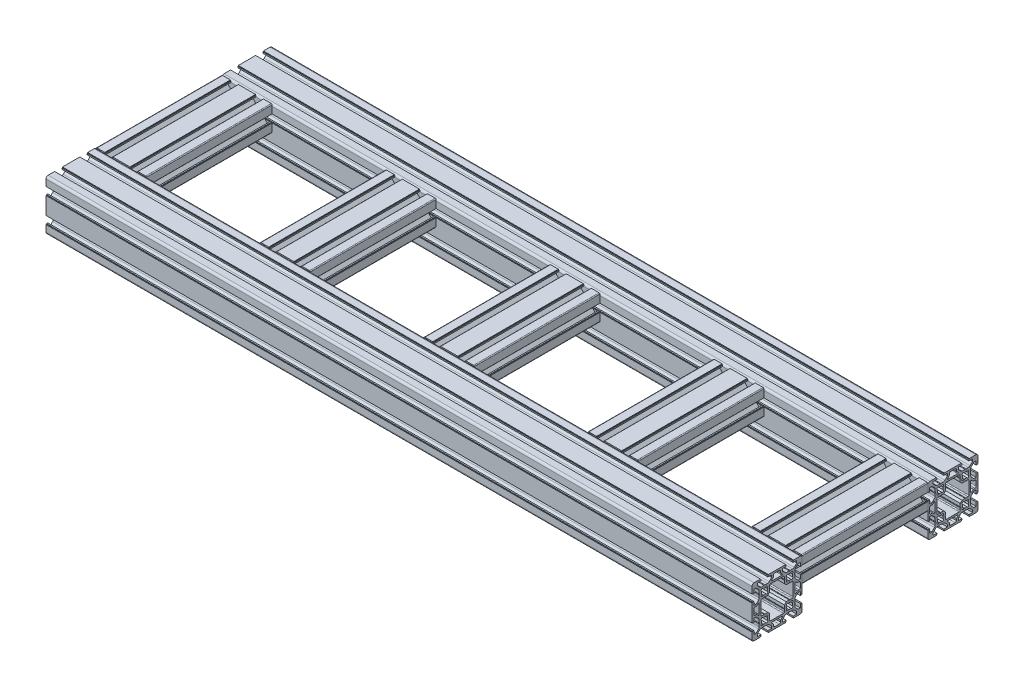
from build123d import *

# Parameters (mm, degrees)
T_SLOT_START                 = -421.5
T_SLOT_CNCCAT_6060_1_DEPTH   = 843
T_SLOT_CNCCAT_6060_1_2_DEPTH = 843
SKETCH24_W                   = 3.960773678
SKETCH24_H                   = 3.960773678
T_SLOT_CNCCAT_3060_1_DEPTH   = 270
LPATTERN1_COUNT              = 5
LPATTERN1_PITCH              = 195.75


with BuildPart() as part:
    # T-slot CNCCAT-6060(1): read off the stored shape, not the designer's step
    # T-slot CNCCAT-6060(1) outline → T-slot CNCCAT-6060(1) (new body)
    with BuildSketch(Plane.YZ.offset(T_SLOT_START)):
        with BuildLine():
            Line((10.9, 2.2), (6.454151397, 2.2))
            Line((6.454151397, 2.2), (6.454151397, 4.924610005))
            Line((6.454151397, 4.924610005), (9.459049047, 7.929507655))
            ThreePointArc((9.459049047, 7.929507655), (10.299878939, 8.491332227), (11.291705423, 8.688618781))
            Line((11.291705423, 8.688618781), (14.439031423, 8.688618781))
            ThreePointArc((14.439031423, 8.688618781), (15, 9.249587358), (15.560968577, 8.688618781))
            Line((15.560968577, 8.688618781), (18.708294577, 8.688618781))
            ThreePointArc((18.708294577, 8.688618781), (19.700121061, 8.491332227), (20.540950953, 7.929507655))
            Line((20.540950953, 7.929507655), (23.545848603, 4.924610005))
            Line((23.545848603, 4.924610005), (23.545848603, 2.2))
            Line((23.545848603, 2.2), (19.1, 2.2))
            Line((19.1, 2.2), (19.1, 0.691051723))
            Line((19.1, 0.691051723), (19.647543128, 0.691051723))
            Line((19.647543128, 0.691051723), (19.647543128, 0))
            Line((19.647543128, 0), (27.5, 0))
            ThreePointArc((27.5, 0), (29.267766953, 0.732233047), (30, 2.5))
            Line((30, 2.5), (30, 10.352456872))
            Line((30, 10.352456872), (29.308948277, 10.352456872))
            Line((29.308948277, 10.352456872), (29.308948277, 10.9))
            Line((29.308948277, 10.9), (27.8, 10.9))
            Line((27.8, 10.9), (27.8, 6.454151397))
            Line((27.8, 6.454151397), (25.075389995, 6.454151397))
            Line((25.075389995, 6.454151397), (22.070492345, 9.459049047))
            ThreePointArc((22.070492345, 9.459049047), (21.508667773, 10.299878939), (21.311381219, 11.291705423))
            Line((21.311381219, 11.291705423), (21.311381219, 14.439031423))
            ThreePointArc((21.311381219, 14.439031423), (20.750412642, 15), (21.311381219, 15.560968577))
            Line((21.311381219, 15.560968577), (21.311381219, 18.708294577))
            ThreePointArc((21.311381219, 18.708294577), (21.508667773, 19.700121061), (22.070492345, 20.540950953))
            Line((22.070492345, 20.540950953), (25.075389995, 23.545848603))
            Line((25.075389995, 23.545848603), (27.8, 23.545848603))
            Line((27.8, 23.545848603), (27.8, 19.1))
            Line((27.8, 19.1), (29.308948277, 19.1))
            Line((29.308948277, 19.1), (29.308948277, 19.647543128))
            Line((29.308948277, 19.647543128), (30, 19.647543128))
            Line((30, 19.647543128), (30, 40.352456872))
            Line((30, 40.352456872), (29.308948277, 40.352456872))
            Line((29.308948277, 40.352456872), (29.308948277, 40.9))
            Line((29.308948277, 40.9), (27.8, 40.9))
            Line((27.8, 40.9), (27.8, 36.454151397))
            Line((27.8, 36.454151397), (25.075389995, 36.454151397))
            Line((25.075389995, 36.454151397), (22.070492345, 39.459049047))
            ThreePointArc((22.070492345, 39.459049047), (21.508667773, 40.299878939), (21.311381219, 41.291705423))
            Line((21.311381219, 41.291705423), (21.311381219, 44.439031423))
            ThreePointArc((21.311381219, 44.439031423), (20.750412642, 45), (21.311381219, 45.560968577))
            Line((21.311381219, 45.560968577), (21.311381219, 48.708294577))
            ThreePointArc((21.311381219, 48.708294577), (21.508667773, 49.700121061), (22.070492345, 50.540950953))
            Line((22.070492345, 50.540950953), (25.075389995, 53.545848603))
            Line((25.075389995, 53.545848603), (27.8, 53.545848603))
            Line((27.8, 53.545848603), (27.8, 49.1))
            Line((27.8, 49.1), (29.308948277, 49.1))
            Line((29.308948277, 49.1), (29.308948277, 49.647543128))
            Line((29.308948277, 49.647543128), (30, 49.647543128))
            Line((30, 49.647543128), (30, 57.5))
            ThreePointArc((30, 57.5), (29.267766953, 59.267766953), (27.5, 60))
            Line((27.5, 60), (19.647543128, 60))
            Line((19.647543128, 60), (19.647543128, 59.308948277))
            Line((19.647543128, 59.308948277), (19.1, 59.308948277))
            Line((19.1, 59.308948277), (19.1, 57.8))
            Line((19.1, 57.8), (23.545848603, 57.8))
            Line((23.545848603, 57.8), (23.545848603, 55.075389995))
            Line((23.545848603, 55.075389995), (20.540950953, 52.070492345))
            ThreePointArc((20.540950953, 52.070492345), (19.700121061, 51.508667773), (18.708294577, 51.311381219))
            Line((18.708294577, 51.311381219), (15.560968577, 51.311381219))
            ThreePointArc((15.560968577, 51.311381219), (15, 50.750412642), (14.439031423, 51.311381219))
            Line((14.439031423, 51.311381219), (11.291705423, 51.311381219))
            ThreePointArc((11.291705423, 51.311381219), (10.299878939, 51.508667773), (9.459049047, 52.070492345))
            Line((9.459049047, 52.070492345), (6.454151397, 55.075389995))
            Line((6.454151397, 55.075389995), (6.454151397, 57.8))
            Line((6.454151397, 57.8), (10.9, 57.8))
            Line((10.9, 57.8), (10.9, 59.308948277))
            Line((10.9, 59.308948277), (10.352456872, 59.308948277))
            Line((10.352456872, 59.308948277), (10.352456872, 60))
            Line((10.352456872, 60), (-10.352456872, 60))
            Line((-10.352456872, 60), (-10.352456872, 59.308948277))
            Line((-10.352456872, 59.308948277), (-10.9, 59.308948277))
            Line((-10.9, 59.308948277), (-10.9, 57.8))
            Line((-10.9, 57.8), (-6.454151397, 57.8))
            Line((-6.454151397, 57.8), (-6.454151397, 55.075389995))
            Line((-6.454151397, 55.075389995), (-9.459049047, 52.070492345))
            ThreePointArc((-9.459049047, 52.070492345), (-10.299878939, 51.508667773), (-11.291705423, 51.311381219))
            Line((-11.291705423, 51.311381219), (-14.439031423, 51.311381219))
            ThreePointArc((-14.439031423, 51.311381219), (-15, 50.750412642), (-15.560968577, 51.311381219))
            Line((-15.560968577, 51.311381219), (-18.708294577, 51.311381219))
            ThreePointArc((-18.708294577, 51.311381219), (-19.700121061, 51.508667773), (-20.540950953, 52.070492345))
            Line((-20.540950953, 52.070492345), (-23.545848603, 55.075389995))
            Line((-23.545848603, 55.075389995), (-23.545848603, 57.8))
            Line((-23.545848603, 57.8), (-19.1, 57.8))
            Line((-19.1, 57.8), (-19.1, 59.308948277))
            Line((-19.1, 59.308948277), (-19.647543128, 59.308948277))
            Line((-19.647543128, 59.308948277), (-19.647543128, 60))
            Line((-19.647543128, 60), (-27.5, 60))
            ThreePointArc((-27.5, 60), (-29.267766953, 59.267766953), (-30, 57.5))
            Line((-30, 57.5), (-30, 49.647543128))
            Line((-30, 49.647543128), (-29.308948277, 49.647543128))
            Line((-29.308948277, 49.647543128), (-29.308948277, 49.1))
            Line((-29.308948277, 49.1), (-27.8, 49.1))
            Line((-27.8, 49.1), (-27.8, 53.545848603))
            Line((-27.8, 53.545848603), (-25.075389995, 53.545848603))
            Line((-25.075389995, 53.545848603), (-22.070492345, 50.540950953))
            ThreePointArc((-22.070492345, 50.540950953), (-21.508667773, 49.700121061), (-21.311381219, 48.708294577))
            Line((-21.311381219, 48.708294577), (-21.311381219, 45.560968577))
            ThreePointArc((-21.311381219, 45.560968577), (-20.750412642, 45), (-21.311381219, 44.439031423))
            Line((-21.311381219, 44.439031423), (-21.311381219, 41.291705423))
            ThreePointArc((-21.311381219, 41.291705423), (-21.508667773, 40.299878939), (-22.070492345, 39.459049047))
            Line((-22.070492345, 39.459049047), (-25.075389995, 36.454151397))
            Line((-25.075389995, 36.454151397), (-27.8, 36.454151397))
            Line((-27.8, 36.454151397), (-27.8, 40.9))
            Line((-27.8, 40.9), (-29.308948277, 40.9))
            Line((-29.308948277, 40.9), (-29.308948277, 40.352456872))
            Line((-29.308948277, 40.352456872), (-30, 40.352456872))
            Line((-30, 40.352456872), (-30, 19.647543128))
            Line((-30, 19.647543128), (-29.308948277, 19.647543128))
            Line((-29.308948277, 19.647543128), (-29.308948277, 19.1))
            Line((-29.308948277, 19.1), (-27.8, 19.1))
            Line((-27.8, 19.1), (-27.8, 23.545848603))
            Line((-27.8, 23.545848603), (-25.075389995, 23.545848603))
            Line((-25.075389995, 23.545848603), (-22.070492345, 20.540950953))
            ThreePointArc((-22.070492345, 20.540950953), (-21.508667773, 19.700121061), (-21.311381219, 18.708294577))
            Line((-21.311381219, 18.708294577), (-21.311381219, 15.560968577))
            ThreePointArc((-21.311381219, 15.560968577), (-20.750412642, 15), (-21.311381219, 14.439031423))
            Line((-21.311381219, 14.439031423), (-21.311381219, 11.291705423))
            ThreePointArc((-21.311381219, 11.291705423), (-21.508667773, 10.299878939), (-22.070492345, 9.459049047))
            Line((-22.070492345, 9.459049047), (-25.075389995, 6.454151397))
            Line((-25.075389995, 6.454151397), (-27.8, 6.454151397))
            Line((-27.8, 6.454151397), (-27.8, 10.9))
            Line((-27.8, 10.9), (-29.308948277, 10.9))
            Line((-29.308948277, 10.9), (-29.308948277, 10.352456872))
            Line((-29.308948277, 10.352456872), (-30, 10.352456872))
            Line((-30, 10.352456872), (-30, 2.5))
            ThreePointArc((-30, 2.5), (-29.267766953, 0.732233047), (-27.5, 0))
            Line((-27.5, 0), (-19.647543128, 0))
            Line((-19.647543128, 0), (-19.647543128, 0.691051723))
            Line((-19.647543128, 0.691051723), (-19.1, 0.691051723))
            Line((-19.1, 0.691051723), (-19.1, 2.2))
            Line((-19.1, 2.2), (-23.545848603, 2.2))
            Line((-23.545848603, 2.2), (-23.545848603, 4.924610005))
            Line((-23.545848603, 4.924610005), (-20.540950953, 7.929507655))
            ThreePointArc((-20.540950953, 7.929507655), (-19.700121061, 8.491332227), (-18.708294577, 8.688618781))
            Line((-18.708294577, 8.688618781), (-15.560968577, 8.688618781))
            ThreePointArc((-15.560968577, 8.688618781), (-15, 9.249587358), (-14.439031423, 8.688618781))
            Line((-14.439031423, 8.688618781), (-11.291705423, 8.688618781))
            ThreePointArc((-11.291705423, 8.688618781), (-10.299878939, 8.491332227), (-9.459049047, 7.929507655))
            Line((-9.459049047, 7.929507655), (-6.454151397, 4.924610005))
            Line((-6.454151397, 4.924610005), (-6.454151397, 2.2))
            Line((-6.454151397, 2.2), (-10.9, 2.2))
            Line((-10.9, 2.2), (-10.9, 0.691051723))
            Line((-10.9, 0.691051723), (-10.352456872, 0.691051723))
            Line((-10.352456872, 0.691051723), (-10.352456872, 0))
            Line((-10.352456872, 0), (10.352456872, 0))
            Line((10.352456872, 0), (10.352456872, 0.691051723))
            Line((10.352456872, 0.691051723), (10.9, 0.691051723))
            Line((10.9, 0.691051723), (10.9, 2.2))
        make_face()
        with BuildLine():
            ThreePointArc((-16.842597476, 11.397388916), (-18.602611084, 11.397388916), (-18.602611084, 13.157402524))
            Line((-18.602611084, 13.157402524), (-18.193140614, 13.566872993))
            ThreePointArc((-18.193140614, 13.566872993), (-18.5, 15), (-18.193140614, 16.433127007))
            Line((-18.193140614, 16.433127007), (-18.602611084, 16.842597476))
            ThreePointArc((-18.602611084, 16.842597476), (-18.602611084, 18.602611084), (-16.842597476, 18.602611084))
            Line((-16.842597476, 18.602611084), (-16.433127007, 18.193140614))
            ThreePointArc((-16.433127007, 18.193140614), (-15, 18.5), (-13.566872993, 18.193140614))
            Line((-13.566872993, 18.193140614), (-13.157402524, 18.602611084))
            ThreePointArc((-13.157402524, 18.602611084), (-11.397388916, 18.602611084), (-11.397388916, 16.842597476))
            Line((-11.397388916, 16.842597476), (-11.806859386, 16.433127007))
            ThreePointArc((-11.806859386, 16.433127007), (-11.5, 15), (-11.806859386, 13.566872993))
            Line((-11.806859386, 13.566872993), (-11.397388916, 13.157402524))
            ThreePointArc((-11.397388916, 13.157402524), (-11.397388916, 11.397388916), (-13.157402524, 11.397388916))
            Line((-13.157402524, 11.397388916), (-13.566872993, 11.806859386))
            ThreePointArc((-13.566872993, 11.806859386), (-15, 11.5), (-16.433127007, 11.806859386))
            Line((-16.433127007, 11.806859386), (-16.842597476, 11.397388916))
        make_face(mode=Mode.SUBTRACT)
        with BuildLine():
            ThreePointArc((4.26564751, 3.554594496), (3.694557458, 2.582797776), (2.634369467, 2.2))
            Line((2.634369467, 2.2), (-2.634369467, 2.2))
            ThreePointArc((-2.634369467, 2.2), (-3.694557458, 2.582797776), (-4.26564751, 3.554594496))
            Line((-4.26564751, 3.554594496), (-4.26564751, 5.603852837))
            Line((-4.26564751, 5.603852837), (-6.282040861, 7.75997248))
            ThreePointArc((-6.282040861, 7.75997248), (-6.388091607, 8.373205301), (-5.867763364, 8.714613814))
            Line((-5.867763364, 8.714613814), (5.867763364, 8.714613814))
            ThreePointArc((5.867763364, 8.714613814), (6.388091607, 8.373205301), (6.282040861, 7.75997248))
            Line((6.282040861, 7.75997248), (4.26564751, 5.603852837))
            Line((4.26564751, 5.603852837), (4.26564751, 3.554594496))
        make_face(mode=Mode.SUBTRACT)
        with BuildLine():
            ThreePointArc((13.157402524, 11.397388916), (11.397388916, 11.397388916), (11.397388916, 13.157402524))
            Line((11.397388916, 13.157402524), (11.806859386, 13.566872993))
            ThreePointArc((11.806859386, 13.566872993), (11.5, 15), (11.806859386, 16.433127007))
            Line((11.806859386, 16.433127007), (11.397388916, 16.842597476))
            ThreePointArc((11.397388916, 16.842597476), (11.397388916, 18.602611084), (13.157402524, 18.602611084))
            Line((13.157402524, 18.602611084), (13.566872993, 18.193140614))
            ThreePointArc((13.566872993, 18.193140614), (15, 18.5), (16.433127007, 18.193140614))
            Line((16.433127007, 18.193140614), (16.842597476, 18.602611084))
            ThreePointArc((16.842597476, 18.602611084), (18.602611084, 18.602611084), (18.602611084, 16.842597476))
            Line((18.602611084, 16.842597476), (18.193140614, 16.433127007))
            ThreePointArc((18.193140614, 16.433127007), (18.5, 15), (18.193140614, 13.566872993))
            Line((18.193140614, 13.566872993), (18.602611084, 13.157402524))
            ThreePointArc((18.602611084, 13.157402524), (18.602611084, 11.397388916), (16.842597476, 11.397388916))
            Line((16.842597476, 11.397388916), (16.433127007, 11.806859386))
            ThreePointArc((16.433127007, 11.806859386), (15, 11.5), (13.566872993, 11.806859386))
            Line((13.566872993, 11.806859386), (13.157402524, 11.397388916))
        make_face(mode=Mode.SUBTRACT)
        with BuildLine():
            Line((-22.24002752, 23.717959139), (-24.396147163, 25.73435249))
            Line((-24.396147163, 25.73435249), (-26.445405504, 25.73435249))
            ThreePointArc((-26.445405504, 25.73435249), (-27.417202224, 26.305442542), (-27.8, 27.365630533))
            Line((-27.8, 27.365630533), (-27.8, 32.634369467))
            ThreePointArc((-27.8, 32.634369467), (-27.417202224, 33.694557458), (-26.445405504, 34.26564751))
            Line((-26.445405504, 34.26564751), (-24.396147163, 34.26564751))
            Line((-24.396147163, 34.26564751), (-22.24002752, 36.282040861))
            ThreePointArc((-22.24002752, 36.282040861), (-21.626794699, 36.388091607), (-21.285386186, 35.867763364))
            Line((-21.285386186, 35.867763364), (-21.285386186, 24.132236636))
            ThreePointArc((-21.285386186, 24.132236636), (-21.626794699, 23.611908393), (-22.24002752, 23.717959139))
        make_face(mode=Mode.SUBTRACT)
        with BuildLine():
            ThreePointArc((-13.157402524, 48.602611084), (-11.397388916, 48.602611084), (-11.397388916, 46.842597476))
            Line((-11.397388916, 46.842597476), (-11.806859386, 46.433127007))
            ThreePointArc((-11.806859386, 46.433127007), (-11.5, 45), (-11.806859386, 43.566872993))
            Line((-11.806859386, 43.566872993), (-11.397388916, 43.157402524))
            ThreePointArc((-11.397388916, 43.157402524), (-11.397388916, 41.397388916), (-13.157402524, 41.397388916))
            Line((-13.157402524, 41.397388916), (-13.566872993, 41.806859386))
            ThreePointArc((-13.566872993, 41.806859386), (-15, 41.5), (-16.433127007, 41.806859386))
            Line((-16.433127007, 41.806859386), (-16.842597476, 41.397388916))
            ThreePointArc((-16.842597476, 41.397388916), (-18.602611084, 41.397388916), (-18.602611084, 43.157402524))
            Line((-18.602611084, 43.157402524), (-18.193140614, 43.566872993))
            ThreePointArc((-18.193140614, 43.566872993), (-18.5, 45), (-18.193140614, 46.433127007))
            Line((-18.193140614, 46.433127007), (-18.602611084, 46.842597476))
            ThreePointArc((-18.602611084, 46.842597476), (-18.602611084, 48.602611084), (-16.842597476, 48.602611084))
            Line((-16.842597476, 48.602611084), (-16.433127007, 48.193140614))
            ThreePointArc((-16.433127007, 48.193140614), (-15, 48.5), (-13.566872993, 48.193140614))
            Line((-13.566872993, 48.193140614), (-13.157402524, 48.602611084))
        make_face(mode=Mode.SUBTRACT)
        with BuildLine():
            ThreePointArc((-8.800723479, 14.442432576), (-9.303525214, 14.945234311), (-8.800723479, 15.448036046))
            Line((-8.800723479, 15.448036046), (-8.800723479, 19.001733605))
            Line((-8.800723479, 19.001733605), (-10.998266395, 21.199276521))
            Line((-10.998266395, 21.199276521), (-14.551963954, 21.199276521))
            ThreePointArc((-14.551963954, 21.199276521), (-15.054765689, 20.696474786), (-15.557567424, 21.199276521))
            Line((-15.557567424, 21.199276521), (-18.034191115, 21.199276521))
            ThreePointArc((-18.034191115, 21.199276521), (-18.830657122, 21.529183543), (-19.160564144, 22.32564955))
            Line((-19.160564144, 22.32564955), (-19.160564144, 37.67435045))
            ThreePointArc((-19.160564144, 37.67435045), (-18.830657122, 38.470816457), (-18.034191115, 38.800723479))
            Line((-18.034191115, 38.800723479), (-15.557567424, 38.800723479))
            ThreePointArc((-15.557567424, 38.800723479), (-15.054765689, 39.303525214), (-14.551963954, 38.800723479))
            Line((-14.551963954, 38.800723479), (-10.998266395, 38.800723479))
            Line((-10.998266395, 38.800723479), (-8.800723479, 40.998266395))
            Line((-8.800723479, 40.998266395), (-8.800723479, 44.551963954))
            ThreePointArc((-8.800723479, 44.551963954), (-9.303525214, 45.054765689), (-8.800723479, 45.557567424))
            Line((-8.800723479, 45.557567424), (-8.800723479, 48.034191115))
            ThreePointArc((-8.800723479, 48.034191115), (-8.470816457, 48.830657122), (-7.67435045, 49.160564144))
            Line((-7.67435045, 49.160564144), (7.67435045, 49.160564144))
            ThreePointArc((7.67435045, 49.160564144), (8.470816457, 48.830657122), (8.800723479, 48.034191115))
            Line((8.800723479, 48.034191115), (8.800723479, 45.557567424))
            ThreePointArc((8.800723479, 45.557567424), (9.303525214, 45.054765689), (8.800723479, 44.551963954))
            Line((8.800723479, 44.551963954), (8.800723479, 40.998266395))
            Line((8.800723479, 40.998266395), (10.998266395, 38.800723479))
            Line((10.998266395, 38.800723479), (14.551963954, 38.800723479))
            ThreePointArc((14.551963954, 38.800723479), (15.054765689, 39.303525214), (15.557567424, 38.800723479))
            Line((15.557567424, 38.800723479), (18.034191115, 38.800723479))
            ThreePointArc((18.034191115, 38.800723479), (18.830657122, 38.470816457), (19.160564144, 37.67435045))
            Line((19.160564144, 37.67435045), (19.160564144, 22.32564955))
            ThreePointArc((19.160564144, 22.32564955), (18.830657122, 21.529183543), (18.034191115, 21.199276521))
            Line((18.034191115, 21.199276521), (15.557567424, 21.199276521))
            ThreePointArc((15.557567424, 21.199276521), (15.054765689, 20.696474786), (14.551963954, 21.199276521))
            Line((14.551963954, 21.199276521), (10.998266395, 21.199276521))
            Line((10.998266395, 21.199276521), (8.800723479, 19.001733605))
            Line((8.800723479, 19.001733605), (8.800723479, 15.448036046))
            ThreePointArc((8.800723479, 15.448036046), (9.303525214, 14.945234311), (8.800723479, 14.442432576))
            Line((8.800723479, 14.442432576), (8.800723479, 11.965808885))
            ThreePointArc((8.800723479, 11.965808885), (8.470816457, 11.169342878), (7.67435045, 10.839435856))
            Line((7.67435045, 10.839435856), (-7.67435045, 10.839435856))
            ThreePointArc((-7.67435045, 10.839435856), (-8.470816457, 11.169342878), (-8.800723479, 11.965808885))
            Line((-8.800723479, 11.965808885), (-8.800723479, 14.442432576))
        make_face(mode=Mode.SUBTRACT)
        with BuildLine():
            Line((22.24002752, 36.282040861), (24.396147163, 34.26564751))
            Line((24.396147163, 34.26564751), (26.445405504, 34.26564751))
            ThreePointArc((26.445405504, 34.26564751), (27.417202224, 33.694557458), (27.8, 32.634369467))
            Line((27.8, 32.634369467), (27.8, 27.365630533))
            ThreePointArc((27.8, 27.365630533), (27.417202224, 26.305442542), (26.445405504, 25.73435249))
            Line((26.445405504, 25.73435249), (24.396147163, 25.73435249))
            Line((24.396147163, 25.73435249), (22.24002752, 23.717959139))
            ThreePointArc((22.24002752, 23.717959139), (21.626794699, 23.611908393), (21.285386186, 24.132236636))
            Line((21.285386186, 24.132236636), (21.285386186, 35.867763364))
            ThreePointArc((21.285386186, 35.867763364), (21.626794699, 36.388091607), (22.24002752, 36.282040861))
        make_face(mode=Mode.SUBTRACT)
        with BuildLine():
            ThreePointArc((6.282040861, 52.24002752), (6.388091607, 51.626794699), (5.867763364, 51.285386186))
            Line((5.867763364, 51.285386186), (-5.867763364, 51.285386186))
            ThreePointArc((-5.867763364, 51.285386186), (-6.388091607, 51.626794699), (-6.282040861, 52.24002752))
            Line((-6.282040861, 52.24002752), (-4.26564751, 54.396147163))
            Line((-4.26564751, 54.396147163), (-4.26564751, 56.445405504))
            ThreePointArc((-4.26564751, 56.445405504), (-3.694557458, 57.417202224), (-2.634369467, 57.8))
            Line((-2.634369467, 57.8), (2.634369467, 57.8))
            ThreePointArc((2.634369467, 57.8), (3.694557458, 57.417202224), (4.26564751, 56.445405504))
            Line((4.26564751, 56.445405504), (4.26564751, 54.396147163))
            Line((4.26564751, 54.396147163), (6.282040861, 52.24002752))
        make_face(mode=Mode.SUBTRACT)
        with BuildLine():
            ThreePointArc((16.842597476, 48.602611084), (18.602611084, 48.602611084), (18.602611084, 46.842597476))
            Line((18.602611084, 46.842597476), (18.193140614, 46.433127007))
            ThreePointArc((18.193140614, 46.433127007), (18.5, 45), (18.193140614, 43.566872993))
            Line((18.193140614, 43.566872993), (18.602611084, 43.157402524))
            ThreePointArc((18.602611084, 43.157402524), (18.602611084, 41.397388916), (16.842597476, 41.397388916))
            Line((16.842597476, 41.397388916), (16.433127007, 41.806859386))
            ThreePointArc((16.433127007, 41.806859386), (15, 41.5), (13.566872993, 41.806859386))
            Line((13.566872993, 41.806859386), (13.157402524, 41.397388916))
            ThreePointArc((13.157402524, 41.397388916), (11.397388916, 41.397388916), (11.397388916, 43.157402524))
            Line((11.397388916, 43.157402524), (11.806859386, 43.566872993))
            ThreePointArc((11.806859386, 43.566872993), (11.5, 45), (11.806859386, 46.433127007))
            Line((11.806859386, 46.433127007), (11.397388916, 46.842597476))
            ThreePointArc((11.397388916, 46.842597476), (11.397388916, 48.602611084), (13.157402524, 48.602611084))
            Line((13.157402524, 48.602611084), (13.566872993, 48.193140614))
            ThreePointArc((13.566872993, 48.193140614), (15, 48.5), (16.433127007, 48.193140614))
            Line((16.433127007, 48.193140614), (16.842597476, 48.602611084))
        make_face(mode=Mode.SUBTRACT)
    extrude(amount=T_SLOT_CNCCAT_6060_1_DEPTH)


with BuildPart() as body_2:
    # T-slot CNCCAT-6060_1 2 outline → T-slot CNCCAT-6060_1 2 (new body)
    with BuildSketch(Plane.YZ.offset(T_SLOT_START)):
        with BuildLine():
            Line((10.9, 212.2), (6.454151397, 212.2))
            Line((6.454151397, 212.2), (6.454151397, 214.924610005))
            Line((6.454151397, 214.924610005), (9.459049047, 217.929507655))
            ThreePointArc((9.459049047, 217.929507655), (10.299878939, 218.491332227), (11.291705423, 218.688618781))
            Line((11.291705423, 218.688618781), (14.439031423, 218.688618781))
            ThreePointArc((14.439031423, 218.688618781), (15, 219.249587358), (15.560968577, 218.688618781))
            Line((15.560968577, 218.688618781), (18.708294577, 218.688618781))
            ThreePointArc((18.708294577, 218.688618781), (19.700121061, 218.491332227), (20.540950953, 217.929507655))
            Line((20.540950953, 217.929507655), (23.545848603, 214.924610005))
            Line((23.545848603, 214.924610005), (23.545848603, 212.2))
            Line((23.545848603, 212.2), (19.1, 212.2))
            Line((19.1, 212.2), (19.1, 210.691051723))
            Line((19.1, 210.691051723), (19.647543128, 210.691051723))
            Line((19.647543128, 210.691051723), (19.647543128, 210))
            Line((19.647543128, 210), (27.5, 210))
            ThreePointArc((27.5, 210), (29.267766953, 210.732233047), (30, 212.5))
            Line((30, 212.5), (30, 220.352456872))
            Line((30, 220.352456872), (29.308948277, 220.352456872))
            Line((29.308948277, 220.352456872), (29.308948277, 220.9))
            Line((29.308948277, 220.9), (27.8, 220.9))
            Line((27.8, 220.9), (27.8, 216.454151397))
            Line((27.8, 216.454151397), (25.075389995, 216.454151397))
            Line((25.075389995, 216.454151397), (22.070492345, 219.459049047))
            ThreePointArc((22.070492345, 219.459049047), (21.508667773, 220.299878939), (21.311381219, 221.291705423))
            Line((21.311381219, 221.291705423), (21.311381219, 224.439031423))
            ThreePointArc((21.311381219, 224.439031423), (20.750412642, 225), (21.311381219, 225.560968577))
            Line((21.311381219, 225.560968577), (21.311381219, 228.708294577))
            ThreePointArc((21.311381219, 228.708294577), (21.508667773, 229.700121061), (22.070492345, 230.540950953))
            Line((22.070492345, 230.540950953), (25.075389995, 233.545848603))
            Line((25.075389995, 233.545848603), (27.8, 233.545848603))
            Line((27.8, 233.545848603), (27.8, 229.1))
            Line((27.8, 229.1), (29.308948277, 229.1))
            Line((29.308948277, 229.1), (29.308948277, 229.647543128))
            Line((29.308948277, 229.647543128), (30, 229.647543128))
            Line((30, 229.647543128), (30, 250.352456872))
            Line((30, 250.352456872), (29.308948277, 250.352456872))
            Line((29.308948277, 250.352456872), (29.308948277, 250.9))
            Line((29.308948277, 250.9), (27.8, 250.9))
            Line((27.8, 250.9), (27.8, 246.454151397))
            Line((27.8, 246.454151397), (25.075389995, 246.454151397))
            Line((25.075389995, 246.454151397), (22.070492345, 249.459049047))
            ThreePointArc((22.070492345, 249.459049047), (21.508667773, 250.299878939), (21.311381219, 251.291705423))
            Line((21.311381219, 251.291705423), (21.311381219, 254.439031423))
            ThreePointArc((21.311381219, 254.439031423), (20.750412642, 255), (21.311381219, 255.560968577))
            Line((21.311381219, 255.560968577), (21.311381219, 258.708294577))
            ThreePointArc((21.311381219, 258.708294577), (21.508667773, 259.700121061), (22.070492345, 260.540950953))
            Line((22.070492345, 260.540950953), (25.075389995, 263.545848603))
            Line((25.075389995, 263.545848603), (27.8, 263.545848603))
            Line((27.8, 263.545848603), (27.8, 259.1))
            Line((27.8, 259.1), (29.308948277, 259.1))
            Line((29.308948277, 259.1), (29.308948277, 259.647543128))
            Line((29.308948277, 259.647543128), (30, 259.647543128))
            Line((30, 259.647543128), (30, 267.5))
            ThreePointArc((30, 267.5), (29.267766953, 269.267766953), (27.5, 270))
            Line((27.5, 270), (19.647543128, 270))
            Line((19.647543128, 270), (19.647543128, 269.308948277))
            Line((19.647543128, 269.308948277), (19.1, 269.308948277))
            Line((19.1, 269.308948277), (19.1, 267.8))
            Line((19.1, 267.8), (23.545848603, 267.8))
            Line((23.545848603, 267.8), (23.545848603, 265.075389995))
            Line((23.545848603, 265.075389995), (20.540950953, 262.070492345))
            ThreePointArc((20.540950953, 262.070492345), (19.700121061, 261.508667773), (18.708294577, 261.311381219))
            Line((18.708294577, 261.311381219), (15.560968577, 261.311381219))
            ThreePointArc((15.560968577, 261.311381219), (15, 260.750412642), (14.439031423, 261.311381219))
            Line((14.439031423, 261.311381219), (11.291705423, 261.311381219))
            ThreePointArc((11.291705423, 261.311381219), (10.299878939, 261.508667773), (9.459049047, 262.070492345))
            Line((9.459049047, 262.070492345), (6.454151397, 265.075389995))
            Line((6.454151397, 265.075389995), (6.454151397, 267.8))
            Line((6.454151397, 267.8), (10.9, 267.8))
            Line((10.9, 267.8), (10.9, 269.308948277))
            Line((10.9, 269.308948277), (10.352456872, 269.308948277))
            Line((10.352456872, 269.308948277), (10.352456872, 270))
            Line((10.352456872, 270), (-10.352456872, 270))
            Line((-10.352456872, 270), (-10.352456872, 269.308948277))
            Line((-10.352456872, 269.308948277), (-10.9, 269.308948277))
            Line((-10.9, 269.308948277), (-10.9, 267.8))
            Line((-10.9, 267.8), (-6.454151397, 267.8))
            Line((-6.454151397, 267.8), (-6.454151397, 265.075389995))
            Line((-6.454151397, 265.075389995), (-9.459049047, 262.070492345))
            ThreePointArc((-9.459049047, 262.070492345), (-10.299878939, 261.508667773), (-11.291705423, 261.311381219))
            Line((-11.291705423, 261.311381219), (-14.439031423, 261.311381219))
            ThreePointArc((-14.439031423, 261.311381219), (-15, 260.750412642), (-15.560968577, 261.311381219))
            Line((-15.560968577, 261.311381219), (-18.708294577, 261.311381219))
            ThreePointArc((-18.708294577, 261.311381219), (-19.700121061, 261.508667773), (-20.540950953, 262.070492345))
            Line((-20.540950953, 262.070492345), (-23.545848603, 265.075389995))
            Line((-23.545848603, 265.075389995), (-23.545848603, 267.8))
            Line((-23.545848603, 267.8), (-19.1, 267.8))
            Line((-19.1, 267.8), (-19.1, 269.308948277))
            Line((-19.1, 269.308948277), (-19.647543128, 269.308948277))
            Line((-19.647543128, 269.308948277), (-19.647543128, 270))
            Line((-19.647543128, 270), (-27.5, 270))
            ThreePointArc((-27.5, 270), (-29.267766953, 269.267766953), (-30, 267.5))
            Line((-30, 267.5), (-30, 259.647543128))
            Line((-30, 259.647543128), (-29.308948277, 259.647543128))
            Line((-29.308948277, 259.647543128), (-29.308948277, 259.1))
            Line((-29.308948277, 259.1), (-27.8, 259.1))
            Line((-27.8, 259.1), (-27.8, 263.545848603))
            Line((-27.8, 263.545848603), (-25.075389995, 263.545848603))
            Line((-25.075389995, 263.545848603), (-22.070492345, 260.540950953))
            ThreePointArc((-22.070492345, 260.540950953), (-21.508667773, 259.700121061), (-21.311381219, 258.708294577))
            Line((-21.311381219, 258.708294577), (-21.311381219, 255.560968577))
            ThreePointArc((-21.311381219, 255.560968577), (-20.750412642, 255), (-21.311381219, 254.439031423))
            Line((-21.311381219, 254.439031423), (-21.311381219, 251.291705423))
            ThreePointArc((-21.311381219, 251.291705423), (-21.508667773, 250.299878939), (-22.070492345, 249.459049047))
            Line((-22.070492345, 249.459049047), (-25.075389995, 246.454151397))
            Line((-25.075389995, 246.454151397), (-27.8, 246.454151397))
            Line((-27.8, 246.454151397), (-27.8, 250.9))
            Line((-27.8, 250.9), (-29.308948277, 250.9))
            Line((-29.308948277, 250.9), (-29.308948277, 250.352456872))
            Line((-29.308948277, 250.352456872), (-30, 250.352456872))
            Line((-30, 250.352456872), (-30, 229.647543128))
            Line((-30, 229.647543128), (-29.308948277, 229.647543128))
            Line((-29.308948277, 229.647543128), (-29.308948277, 229.1))
            Line((-29.308948277, 229.1), (-27.8, 229.1))
            Line((-27.8, 229.1), (-27.8, 233.545848603))
            Line((-27.8, 233.545848603), (-25.075389995, 233.545848603))
            Line((-25.075389995, 233.545848603), (-22.070492345, 230.540950953))
            ThreePointArc((-22.070492345, 230.540950953), (-21.508667773, 229.700121061), (-21.311381219, 228.708294577))
            Line((-21.311381219, 228.708294577), (-21.311381219, 225.560968577))
            ThreePointArc((-21.311381219, 225.560968577), (-20.750412642, 225), (-21.311381219, 224.439031423))
            Line((-21.311381219, 224.439031423), (-21.311381219, 221.291705423))
            ThreePointArc((-21.311381219, 221.291705423), (-21.508667773, 220.299878939), (-22.070492345, 219.459049047))
            Line((-22.070492345, 219.459049047), (-25.075389995, 216.454151397))
            Line((-25.075389995, 216.454151397), (-27.8, 216.454151397))
            Line((-27.8, 216.454151397), (-27.8, 220.9))
            Line((-27.8, 220.9), (-29.308948277, 220.9))
            Line((-29.308948277, 220.9), (-29.308948277, 220.352456872))
            Line((-29.308948277, 220.352456872), (-30, 220.352456872))
            Line((-30, 220.352456872), (-30, 212.5))
            ThreePointArc((-30, 212.5), (-29.267766953, 210.732233047), (-27.5, 210))
            Line((-27.5, 210), (-19.647543128, 210))
            Line((-19.647543128, 210), (-19.647543128, 210.691051723))
            Line((-19.647543128, 210.691051723), (-19.1, 210.691051723))
            Line((-19.1, 210.691051723), (-19.1, 212.2))
            Line((-19.1, 212.2), (-23.545848603, 212.2))
            Line((-23.545848603, 212.2), (-23.545848603, 214.924610005))
            Line((-23.545848603, 214.924610005), (-20.540950953, 217.929507655))
            ThreePointArc((-20.540950953, 217.929507655), (-19.700121061, 218.491332227), (-18.708294577, 218.688618781))
            Line((-18.708294577, 218.688618781), (-15.560968577, 218.688618781))
            ThreePointArc((-15.560968577, 218.688618781), (-15, 219.249587358), (-14.439031423, 218.688618781))
            Line((-14.439031423, 218.688618781), (-11.291705423, 218.688618781))
            ThreePointArc((-11.291705423, 218.688618781), (-10.299878939, 218.491332227), (-9.459049047, 217.929507655))
            Line((-9.459049047, 217.929507655), (-6.454151397, 214.924610005))
            Line((-6.454151397, 214.924610005), (-6.454151397, 212.2))
            Line((-6.454151397, 212.2), (-10.9, 212.2))
            Line((-10.9, 212.2), (-10.9, 210.691051723))
            Line((-10.9, 210.691051723), (-10.352456872, 210.691051723))
            Line((-10.352456872, 210.691051723), (-10.352456872, 210))
            Line((-10.352456872, 210), (10.352456872, 210))
            Line((10.352456872, 210), (10.352456872, 210.691051723))
            Line((10.352456872, 210.691051723), (10.9, 210.691051723))
            Line((10.9, 210.691051723), (10.9, 212.2))
        make_face()
        with BuildLine():
            ThreePointArc((4.26564751, 213.554594496), (3.694557458, 212.582797776), (2.634369467, 212.2))
            Line((2.634369467, 212.2), (-2.634369467, 212.2))
            ThreePointArc((-2.634369467, 212.2), (-3.694557458, 212.582797776), (-4.26564751, 213.554594496))
            Line((-4.26564751, 213.554594496), (-4.26564751, 215.603852837))
            Line((-4.26564751, 215.603852837), (-6.282040861, 217.75997248))
            ThreePointArc((-6.282040861, 217.75997248), (-6.388091607, 218.373205301), (-5.867763364, 218.714613814))
            Line((-5.867763364, 218.714613814), (5.867763364, 218.714613814))
            ThreePointArc((5.867763364, 218.714613814), (6.388091607, 218.373205301), (6.282040861, 217.75997248))
            Line((6.282040861, 217.75997248), (4.26564751, 215.603852837))
            Line((4.26564751, 215.603852837), (4.26564751, 213.554594496))
        make_face(mode=Mode.SUBTRACT)
        with BuildLine():
            ThreePointArc((-16.842597476, 221.397388916), (-18.602611084, 221.397388916), (-18.602611084, 223.157402524))
            Line((-18.602611084, 223.157402524), (-18.193140614, 223.566872993))
            ThreePointArc((-18.193140614, 223.566872993), (-18.5, 225), (-18.193140614, 226.433127007))
            Line((-18.193140614, 226.433127007), (-18.602611084, 226.842597476))
            ThreePointArc((-18.602611084, 226.842597476), (-18.602611084, 228.602611084), (-16.842597476, 228.602611084))
            Line((-16.842597476, 228.602611084), (-16.433127007, 228.193140614))
            ThreePointArc((-16.433127007, 228.193140614), (-15, 228.5), (-13.566872993, 228.193140614))
            Line((-13.566872993, 228.193140614), (-13.157402524, 228.602611084))
            ThreePointArc((-13.157402524, 228.602611084), (-11.397388916, 228.602611084), (-11.397388916, 226.842597476))
            Line((-11.397388916, 226.842597476), (-11.806859386, 226.433127007))
            ThreePointArc((-11.806859386, 226.433127007), (-11.5, 225), (-11.806859386, 223.566872993))
            Line((-11.806859386, 223.566872993), (-11.397388916, 223.157402524))
            ThreePointArc((-11.397388916, 223.157402524), (-11.397388916, 221.397388916), (-13.157402524, 221.397388916))
            Line((-13.157402524, 221.397388916), (-13.566872993, 221.806859386))
            ThreePointArc((-13.566872993, 221.806859386), (-15, 221.5), (-16.433127007, 221.806859386))
            Line((-16.433127007, 221.806859386), (-16.842597476, 221.397388916))
        make_face(mode=Mode.SUBTRACT)
        with BuildLine():
            ThreePointArc((13.157402524, 221.397388916), (11.397388916, 221.397388916), (11.397388916, 223.157402524))
            Line((11.397388916, 223.157402524), (11.806859386, 223.566872993))
            ThreePointArc((11.806859386, 223.566872993), (11.5, 225), (11.806859386, 226.433127007))
            Line((11.806859386, 226.433127007), (11.397388916, 226.842597476))
            ThreePointArc((11.397388916, 226.842597476), (11.397388916, 228.602611084), (13.157402524, 228.602611084))
            Line((13.157402524, 228.602611084), (13.566872993, 228.193140614))
            ThreePointArc((13.566872993, 228.193140614), (15, 228.5), (16.433127007, 228.193140614))
            Line((16.433127007, 228.193140614), (16.842597476, 228.602611084))
            ThreePointArc((16.842597476, 228.602611084), (18.602611084, 228.602611084), (18.602611084, 226.842597476))
            Line((18.602611084, 226.842597476), (18.193140614, 226.433127007))
            ThreePointArc((18.193140614, 226.433127007), (18.5, 225), (18.193140614, 223.566872993))
            Line((18.193140614, 223.566872993), (18.602611084, 223.157402524))
            ThreePointArc((18.602611084, 223.157402524), (18.602611084, 221.397388916), (16.842597476, 221.397388916))
            Line((16.842597476, 221.397388916), (16.433127007, 221.806859386))
            ThreePointArc((16.433127007, 221.806859386), (15, 221.5), (13.566872993, 221.806859386))
            Line((13.566872993, 221.806859386), (13.157402524, 221.397388916))
        make_face(mode=Mode.SUBTRACT)
        with BuildLine():
            ThreePointArc((-8.800723479, 224.442432576), (-9.303525214, 224.945234311), (-8.800723479, 225.448036046))
            Line((-8.800723479, 225.448036046), (-8.800723479, 229.001733605))
            Line((-8.800723479, 229.001733605), (-10.998266395, 231.199276521))
            Line((-10.998266395, 231.199276521), (-14.551963954, 231.199276521))
            ThreePointArc((-14.551963954, 231.199276521), (-15.054765689, 230.696474786), (-15.557567424, 231.199276521))
            Line((-15.557567424, 231.199276521), (-18.034191115, 231.199276521))
            ThreePointArc((-18.034191115, 231.199276521), (-18.830657122, 231.529183543), (-19.160564144, 232.32564955))
            Line((-19.160564144, 232.32564955), (-19.160564144, 247.67435045))
            ThreePointArc((-19.160564144, 247.67435045), (-18.830657122, 248.470816457), (-18.034191115, 248.800723479))
            Line((-18.034191115, 248.800723479), (-15.557567424, 248.800723479))
            ThreePointArc((-15.557567424, 248.800723479), (-15.054765689, 249.303525214), (-14.551963954, 248.800723479))
            Line((-14.551963954, 248.800723479), (-10.998266395, 248.800723479))
            Line((-10.998266395, 248.800723479), (-8.800723479, 250.998266395))
            Line((-8.800723479, 250.998266395), (-8.800723479, 254.551963954))
            ThreePointArc((-8.800723479, 254.551963954), (-9.303525214, 255.054765689), (-8.800723479, 255.557567424))
            Line((-8.800723479, 255.557567424), (-8.800723479, 258.034191115))
            ThreePointArc((-8.800723479, 258.034191115), (-8.470816457, 258.830657122), (-7.67435045, 259.160564144))
            Line((-7.67435045, 259.160564144), (7.67435045, 259.160564144))
            ThreePointArc((7.67435045, 259.160564144), (8.470816457, 258.830657122), (8.800723479, 258.034191115))
            Line((8.800723479, 258.034191115), (8.800723479, 255.557567424))
            ThreePointArc((8.800723479, 255.557567424), (9.303525214, 255.054765689), (8.800723479, 254.551963954))
            Line((8.800723479, 254.551963954), (8.800723479, 250.998266395))
            Line((8.800723479, 250.998266395), (10.998266395, 248.800723479))
            Line((10.998266395, 248.800723479), (14.551963954, 248.800723479))
            ThreePointArc((14.551963954, 248.800723479), (15.054765689, 249.303525214), (15.557567424, 248.800723479))
            Line((15.557567424, 248.800723479), (18.034191115, 248.800723479))
            ThreePointArc((18.034191115, 248.800723479), (18.830657122, 248.470816457), (19.160564144, 247.67435045))
            Line((19.160564144, 247.67435045), (19.160564144, 232.32564955))
            ThreePointArc((19.160564144, 232.32564955), (18.830657122, 231.529183543), (18.034191115, 231.199276521))
            Line((18.034191115, 231.199276521), (15.557567424, 231.199276521))
            ThreePointArc((15.557567424, 231.199276521), (15.054765689, 230.696474786), (14.551963954, 231.199276521))
            Line((14.551963954, 231.199276521), (10.998266395, 231.199276521))
            Line((10.998266395, 231.199276521), (8.800723479, 229.001733605))
            Line((8.800723479, 229.001733605), (8.800723479, 225.448036046))
            ThreePointArc((8.800723479, 225.448036046), (9.303525214, 224.945234311), (8.800723479, 224.442432576))
            Line((8.800723479, 224.442432576), (8.800723479, 221.965808885))
            ThreePointArc((8.800723479, 221.965808885), (8.470816457, 221.169342878), (7.67435045, 220.839435856))
            Line((7.67435045, 220.839435856), (-7.67435045, 220.839435856))
            ThreePointArc((-7.67435045, 220.839435856), (-8.470816457, 221.169342878), (-8.800723479, 221.965808885))
            Line((-8.800723479, 221.965808885), (-8.800723479, 224.442432576))
        make_face(mode=Mode.SUBTRACT)
        with BuildLine():
            Line((-22.24002752, 233.717959139), (-24.396147163, 235.73435249))
            Line((-24.396147163, 235.73435249), (-26.445405504, 235.73435249))
            ThreePointArc((-26.445405504, 235.73435249), (-27.417202224, 236.305442542), (-27.8, 237.365630533))
            Line((-27.8, 237.365630533), (-27.8, 242.634369467))
            ThreePointArc((-27.8, 242.634369467), (-27.417202224, 243.694557458), (-26.445405504, 244.26564751))
            Line((-26.445405504, 244.26564751), (-24.396147163, 244.26564751))
            Line((-24.396147163, 244.26564751), (-22.24002752, 246.282040861))
            ThreePointArc((-22.24002752, 246.282040861), (-21.626794699, 246.388091607), (-21.285386186, 245.867763364))
            Line((-21.285386186, 245.867763364), (-21.285386186, 234.132236636))
            ThreePointArc((-21.285386186, 234.132236636), (-21.626794699, 233.611908393), (-22.24002752, 233.717959139))
        make_face(mode=Mode.SUBTRACT)
        with BuildLine():
            ThreePointArc((-13.157402524, 258.602611084), (-11.397388916, 258.602611084), (-11.397388916, 256.842597476))
            Line((-11.397388916, 256.842597476), (-11.806859386, 256.433127007))
            ThreePointArc((-11.806859386, 256.433127007), (-11.5, 255), (-11.806859386, 253.566872993))
            Line((-11.806859386, 253.566872993), (-11.397388916, 253.157402524))
            ThreePointArc((-11.397388916, 253.157402524), (-11.397388916, 251.397388916), (-13.157402524, 251.397388916))
            Line((-13.157402524, 251.397388916), (-13.566872993, 251.806859386))
            ThreePointArc((-13.566872993, 251.806859386), (-15, 251.5), (-16.433127007, 251.806859386))
            Line((-16.433127007, 251.806859386), (-16.842597476, 251.397388916))
            ThreePointArc((-16.842597476, 251.397388916), (-18.602611084, 251.397388916), (-18.602611084, 253.157402524))
            Line((-18.602611084, 253.157402524), (-18.193140614, 253.566872993))
            ThreePointArc((-18.193140614, 253.566872993), (-18.5, 255), (-18.193140614, 256.433127007))
            Line((-18.193140614, 256.433127007), (-18.602611084, 256.842597476))
            ThreePointArc((-18.602611084, 256.842597476), (-18.602611084, 258.602611084), (-16.842597476, 258.602611084))
            Line((-16.842597476, 258.602611084), (-16.433127007, 258.193140614))
            ThreePointArc((-16.433127007, 258.193140614), (-15, 258.5), (-13.566872993, 258.193140614))
            Line((-13.566872993, 258.193140614), (-13.157402524, 258.602611084))
        make_face(mode=Mode.SUBTRACT)
        with BuildLine():
            Line((22.24002752, 246.282040861), (24.396147163, 244.26564751))
            Line((24.396147163, 244.26564751), (26.445405504, 244.26564751))
            ThreePointArc((26.445405504, 244.26564751), (27.417202224, 243.694557458), (27.8, 242.634369467))
            Line((27.8, 242.634369467), (27.8, 237.365630533))
            ThreePointArc((27.8, 237.365630533), (27.417202224, 236.305442542), (26.445405504, 235.73435249))
            Line((26.445405504, 235.73435249), (24.396147163, 235.73435249))
            Line((24.396147163, 235.73435249), (22.24002752, 233.717959139))
            ThreePointArc((22.24002752, 233.717959139), (21.626794699, 233.611908393), (21.285386186, 234.132236636))
            Line((21.285386186, 234.132236636), (21.285386186, 245.867763364))
            ThreePointArc((21.285386186, 245.867763364), (21.626794699, 246.388091607), (22.24002752, 246.282040861))
        make_face(mode=Mode.SUBTRACT)
        with BuildLine():
            ThreePointArc((16.842597476, 258.602611084), (18.602611084, 258.602611084), (18.602611084, 256.842597476))
            Line((18.602611084, 256.842597476), (18.193140614, 256.433127007))
            ThreePointArc((18.193140614, 256.433127007), (18.5, 255), (18.193140614, 253.566872993))
            Line((18.193140614, 253.566872993), (18.602611084, 253.157402524))
            ThreePointArc((18.602611084, 253.157402524), (18.602611084, 251.397388916), (16.842597476, 251.397388916))
            Line((16.842597476, 251.397388916), (16.433127007, 251.806859386))
            ThreePointArc((16.433127007, 251.806859386), (15, 251.5), (13.566872993, 251.806859386))
            Line((13.566872993, 251.806859386), (13.157402524, 251.397388916))
            ThreePointArc((13.157402524, 251.397388916), (11.397388916, 251.397388916), (11.397388916, 253.157402524))
            Line((11.397388916, 253.157402524), (11.806859386, 253.566872993))
            ThreePointArc((11.806859386, 253.566872993), (11.5, 255), (11.806859386, 256.433127007))
            Line((11.806859386, 256.433127007), (11.397388916, 256.842597476))
            ThreePointArc((11.397388916, 256.842597476), (11.397388916, 258.602611084), (13.157402524, 258.602611084))
            Line((13.157402524, 258.602611084), (13.566872993, 258.193140614))
            ThreePointArc((13.566872993, 258.193140614), (15, 258.5), (16.433127007, 258.193140614))
            Line((16.433127007, 258.193140614), (16.842597476, 258.602611084))
        make_face(mode=Mode.SUBTRACT)
        with BuildLine():
            ThreePointArc((6.282040861, 262.24002752), (6.388091607, 261.626794699), (5.867763364, 261.285386186))
            Line((5.867763364, 261.285386186), (-5.867763364, 261.285386186))
            ThreePointArc((-5.867763364, 261.285386186), (-6.388091607, 261.626794699), (-6.282040861, 262.24002752))
            Line((-6.282040861, 262.24002752), (-4.26564751, 264.396147163))
            Line((-4.26564751, 264.396147163), (-4.26564751, 266.445405504))
            ThreePointArc((-4.26564751, 266.445405504), (-3.694557458, 267.417202224), (-2.634369467, 267.8))
            Line((-2.634369467, 267.8), (2.634369467, 267.8))
            ThreePointArc((2.634369467, 267.8), (3.694557458, 267.417202224), (4.26564751, 266.445405504))
            Line((4.26564751, 266.445405504), (4.26564751, 264.396147163))
            Line((4.26564751, 264.396147163), (6.282040861, 262.24002752))
        make_face(mode=Mode.SUBTRACT)
    extrude(amount=T_SLOT_CNCCAT_6060_1_2_DEPTH)


with BuildPart() as body_3:
    # Sketch24 → T-slot CNCCAT-3060(1) (new body)
    with BuildSketch(Plane(origin=(391.5, 15, 270), x_dir=(1, 0, 0), z_dir=(0, 0, -1))):
        with BuildLine():
            Line((-20.337121873, 0), (-20.956716316, -0.619594443))
            Line((-20.956716316, -0.619594443), (-20.956716316, -4.401081398))
            Line((-20.956716316, -4.401081398), (-24.863654578, -8.30801966))
            Line((-24.863654578, -8.30801966), (-27.8, -8.30801966))
            Line((-27.8, -8.30801966), (-27.8, -4.1))
            Line((-27.8, -4.1), (-29.233870922, -4.1))
            Line((-29.233870922, -4.1), (-29.233870922, -4.756280561))
            Line((-29.233870922, -4.756280561), (-30, -4.756280561))
            Line((-30, -4.756280561), (-30, -14))
            ThreePointArc((-30, -14), (-29.707106781, -14.707106781), (-29, -15))
            Line((-29, -15), (-19.756280561, -15))
            Line((-19.756280561, -15), (-19.756280561, -14.233870922))
            Line((-19.756280561, -14.233870922), (-19.1, -14.233870922))
            Line((-19.1, -14.233870922), (-19.1, -12.8))
            Line((-19.1, -12.8), (-23.30801966, -12.8))
            Line((-23.30801966, -12.8), (-23.30801966, -9.863654578))
            Line((-23.30801966, -9.863654578), (-19.401081398, -5.956716316))
            Line((-19.401081398, -5.956716316), (-15.619594443, -5.956716316))
            Line((-15.619594443, -5.956716316), (-15, -5.337121873))
            Line((-15, -5.337121873), (-14.380405557, -5.956716316))
            Line((-14.380405557, -5.956716316), (-10.598918602, -5.956716316))
            Line((-10.598918602, -5.956716316), (-6.69198034, -9.863654578))
            Line((-6.69198034, -9.863654578), (-6.69198034, -12.8))
            Line((-6.69198034, -12.8), (-10.9, -12.8))
            Line((-10.9, -12.8), (-10.9, -14.233870922))
            Line((-10.9, -14.233870922), (-10.243719439, -14.233870922))
            Line((-10.243719439, -14.233870922), (-10.243719439, -15))
            Line((-10.243719439, -15), (10.243719439, -15))
            Line((10.243719439, -15), (10.243719439, -14.233870922))
            Line((10.243719439, -14.233870922), (10.9, -14.233870922))
            Line((10.9, -14.233870922), (10.9, -12.8))
            Line((10.9, -12.8), (6.69198034, -12.8))
            Line((6.69198034, -12.8), (6.69198034, -9.863654578))
            Line((6.69198034, -9.863654578), (10.598918602, -5.956716316))
            Line((10.598918602, -5.956716316), (14.380405557, -5.956716316))
            Line((14.380405557, -5.956716316), (15, -5.337121873))
            Line((15, -5.337121873), (15.619594443, -5.956716316))
            Line((15.619594443, -5.956716316), (19.401081398, -5.956716316))
            Line((19.401081398, -5.956716316), (23.30801966, -9.863654578))
            Line((23.30801966, -9.863654578), (23.30801966, -12.8))
            Line((23.30801966, -12.8), (19.1, -12.8))
            Line((19.1, -12.8), (19.1, -14.233870922))
            Line((19.1, -14.233870922), (19.756280561, -14.233870922))
            Line((19.756280561, -14.233870922), (19.756280561, -15))
            Line((19.756280561, -15), (29, -15))
            ThreePointArc((29, -15), (29.707106781, -14.707106781), (30, -14))
            Line((30, -14), (30, -4.756280561))
            Line((30, -4.756280561), (29.233870922, -4.756280561))
            Line((29.233870922, -4.756280561), (29.233870922, -4.1))
            Line((29.233870922, -4.1), (27.8, -4.1))
            Line((27.8, -4.1), (27.8, -8.30801966))
            Line((27.8, -8.30801966), (24.863654578, -8.30801966))
            Line((24.863654578, -8.30801966), (20.956716316, -4.401081398))
            Line((20.956716316, -4.401081398), (20.956716316, -0.619594443))
            Line((20.956716316, -0.619594443), (20.337121873, 0))
            Line((20.337121873, 0), (20.956716316, 0.619594443))
            Line((20.956716316, 0.619594443), (20.956716316, 4.401081398))
            Line((20.956716316, 4.401081398), (24.863654578, 8.30801966))
            Line((24.863654578, 8.30801966), (27.8, 8.30801966))
            Line((27.8, 8.30801966), (27.8, 4.1))
            Line((27.8, 4.1), (29.233870922, 4.1))
            Line((29.233870922, 4.1), (29.233870922, 4.756280561))
            Line((29.233870922, 4.756280561), (30, 4.756280561))
            Line((30, 4.756280561), (30, 14))
            ThreePointArc((30, 14), (29.707106781, 14.707106781), (29, 15))
            Line((29, 15), (19.756280561, 15))
            Line((19.756280561, 15), (19.756280561, 14.233870922))
            Line((19.756280561, 14.233870922), (19.1, 14.233870922))
            Line((19.1, 14.233870922), (19.1, 12.8))
            Line((19.1, 12.8), (23.30801966, 12.8))
            Line((23.30801966, 12.8), (23.30801966, 9.863654578))
            Line((23.30801966, 9.863654578), (19.401081398, 5.956716316))
            Line((19.401081398, 5.956716316), (15.619594443, 5.956716316))
            Line((15.619594443, 5.956716316), (15, 5.337121873))
            Line((15, 5.337121873), (14.380405557, 5.956716316))
            Line((14.380405557, 5.956716316), (10.598918602, 5.956716316))
            Line((10.598918602, 5.956716316), (6.69198034, 9.863654578))
            Line((6.69198034, 9.863654578), (6.69198034, 12.8))
            Line((6.69198034, 12.8), (10.9, 12.8))
            Line((10.9, 12.8), (10.9, 14.233870922))
            Line((10.9, 14.233870922), (10.243719439, 14.233870922))
            Line((10.243719439, 14.233870922), (10.243719439, 15))
            Line((10.243719439, 15), (-10.243719439, 15))
            Line((-10.243719439, 15), (-10.243719439, 14.233870922))
            Line((-10.243719439, 14.233870922), (-10.9, 14.233870922))
            Line((-10.9, 14.233870922), (-10.9, 12.8))
            Line((-10.9, 12.8), (-6.69198034, 12.8))
            Line((-6.69198034, 12.8), (-6.69198034, 9.863654578))
            Line((-6.69198034, 9.863654578), (-10.598918602, 5.956716316))
            Line((-10.598918602, 5.956716316), (-14.380405557, 5.956716316))
            Line((-14.380405557, 5.956716316), (-15, 5.337121873))
            Line((-15, 5.337121873), (-15.619594443, 5.956716316))
            Line((-15.619594443, 5.956716316), (-19.401081398, 5.956716316))
            Line((-19.401081398, 5.956716316), (-23.30801966, 9.863654578))
            Line((-23.30801966, 9.863654578), (-23.30801966, 12.8))
            Line((-23.30801966, 12.8), (-19.1, 12.8))
            Line((-19.1, 12.8), (-19.1, 14.233870922))
            Line((-19.1, 14.233870922), (-19.756280561, 14.233870922))
            Line((-19.756280561, 14.233870922), (-19.756280561, 15))
            Line((-19.756280561, 15), (-29, 15))
            ThreePointArc((-29, 15), (-29.707106781, 14.707106781), (-30, 14))
            Line((-30, 14), (-30, 4.756280561))
            Line((-30, 4.756280561), (-29.233870922, 4.756280561))
            Line((-29.233870922, 4.756280561), (-29.233870922, 4.1))
            Line((-29.233870922, 4.1), (-27.8, 4.1))
            Line((-27.8, 4.1), (-27.8, 8.30801966))
            Line((-27.8, 8.30801966), (-24.863654578, 8.30801966))
            Line((-24.863654578, 8.30801966), (-20.956716316, 4.401081398))
            Line((-20.956716316, 4.401081398), (-20.956716316, 0.619594443))
            Line((-20.956716316, 0.619594443), (-20.337121873, 0))
        make_face()
        with Locations((26.75, 11.75)):
            Rectangle(SKETCH24_W, SKETCH24_H, mode=Mode.SUBTRACT)
        with BuildLine():
            Line((19.109450474, -2.695236912), (18.078815026, -1.664601464))
            ThreePointArc((18.078815026, -1.664601464), (18.5, 0), (18.078815026, 1.664601464))
            Line((18.078815026, 1.664601464), (19.109450474, 2.695236912))
            ThreePointArc((19.109450474, 2.695236912), (19.109450474, 4.109450474), (17.695236912, 4.109450474))
            Line((17.695236912, 4.109450474), (16.664601464, 3.078815026))
            ThreePointArc((16.664601464, 3.078815026), (15, 3.5), (13.335398536, 3.078815026))
            Line((13.335398536, 3.078815026), (12.304763088, 4.109450474))
            ThreePointArc((12.304763088, 4.109450474), (10.890549526, 4.109450474), (10.890549526, 2.695236912))
            Line((10.890549526, 2.695236912), (11.921184974, 1.664601464))
            ThreePointArc((11.921184974, 1.664601464), (11.5, 0), (11.921184974, -1.664601464))
            Line((11.921184974, -1.664601464), (10.890549526, -2.695236912))
            ThreePointArc((10.890549526, -2.695236912), (10.890549526, -4.109450474), (12.304763088, -4.109450474))
            Line((12.304763088, -4.109450474), (13.335398536, -3.078815026))
            ThreePointArc((13.335398536, -3.078815026), (15, -3.5), (16.664601464, -3.078815026))
            Line((16.664601464, -3.078815026), (17.695236912, -4.109450474))
            ThreePointArc((17.695236912, -4.109450474), (19.109450474, -4.109450474), (19.109450474, -2.695236912))
        make_face(mode=Mode.SUBTRACT)
        Polygon((-4.49198034, -12.8), (4.49198034, -12.8), (4.49198034, -8.952384741), (9.043283684, -4.401081398), (9.043283684, -0.619594443), (9.662878127, 0), (9.043283684, 0.619594443), (9.043283684, 4.401081398), (4.49198034, 8.952384741), (4.49198034, 12.8), (-4.49198034, 12.8), (-4.49198034, 8.952384741), (-9.043283684, 4.401081398), (-9.043283684, 0.619594443), (-9.662878127, 0), (-9.043283684, -0.619594443), (-9.043283684, -4.401081398), (-4.49198034, -8.952384741), align=None, mode=Mode.SUBTRACT)
        with Locations((26.75, -11.75)):
            Rectangle(SKETCH24_W, SKETCH24_H, mode=Mode.SUBTRACT)
        with Locations((-26.75, 11.75)):
            Rectangle(SKETCH24_W, SKETCH24_H, mode=Mode.SUBTRACT)
        with BuildLine():
            Line((-19.109450474, 2.695236912), (-18.078815026, 1.664601464))
            ThreePointArc((-18.078815026, 1.664601464), (-18.5, 0), (-18.078815026, -1.664601464))
            Line((-18.078815026, -1.664601464), (-19.109450474, -2.695236912))
            ThreePointArc((-19.109450474, -2.695236912), (-19.109450474, -4.109450474), (-17.695236912, -4.109450474))
            Line((-17.695236912, -4.109450474), (-16.664601464, -3.078815026))
            ThreePointArc((-16.664601464, -3.078815026), (-15, -3.5), (-13.335398536, -3.078815026))
            Line((-13.335398536, -3.078815026), (-12.304763088, -4.109450474))
            ThreePointArc((-12.304763088, -4.109450474), (-10.890549526, -4.109450474), (-10.890549526, -2.695236912))
            Line((-10.890549526, -2.695236912), (-11.921184974, -1.664601464))
            ThreePointArc((-11.921184974, -1.664601464), (-11.5, 0), (-11.921184974, 1.664601464))
            Line((-11.921184974, 1.664601464), (-10.890549526, 2.695236912))
            ThreePointArc((-10.890549526, 2.695236912), (-10.890549526, 4.109450474), (-12.304763088, 4.109450474))
            Line((-12.304763088, 4.109450474), (-13.335398536, 3.078815026))
            ThreePointArc((-13.335398536, 3.078815026), (-15, 3.5), (-16.664601464, 3.078815026))
            Line((-16.664601464, 3.078815026), (-17.695236912, 4.109450474))
            ThreePointArc((-17.695236912, 4.109450474), (-19.109450474, 4.109450474), (-19.109450474, 2.695236912))
        make_face(mode=Mode.SUBTRACT)
        with Locations((-26.75, -11.75)):
            Rectangle(SKETCH24_W, SKETCH24_H, mode=Mode.SUBTRACT)
    extrude(amount=T_SLOT_CNCCAT_3060_1_DEPTH)

    # Trim_Extend2 5
    split(bisect_by=Plane.YX.offset(-210), keep=Keep.TOP)

    # Trim_Extend2 44
    split(bisect_by=Plane(origin=(0, 0, 60), x_dir=(0, -1, 0), z_dir=(0, 0, 1)), keep=Keep.TOP)


with BuildPart() as lpattern1_1:
    # LPattern1: pattern copy
    add(body_3.part.moved(Location(Vector(-1, 0, 0) * (1 * LPATTERN1_PITCH))))


with BuildPart() as lpattern1_2:
    # LPattern1: pattern copy
    add(body_3.part.moved(Location(Vector(-1, 0, 0) * (2 * LPATTERN1_PITCH))))


with BuildPart() as lpattern1_3:
    # LPattern1: pattern copy
    add(body_3.part.moved(Location(Vector(-1, 0, 0) * (3 * LPATTERN1_PITCH))))


with BuildPart() as lpattern1_4:
    # LPattern1: pattern copy
    add(body_3.part.moved(Location(Vector(-1, 0, 0) * (4 * LPATTERN1_PITCH))))


solid = Compound([part.part, body_2.part, body_3.part, lpattern1_1.part, lpattern1_2.part, lpattern1_3.part, lpattern1_4.part])
